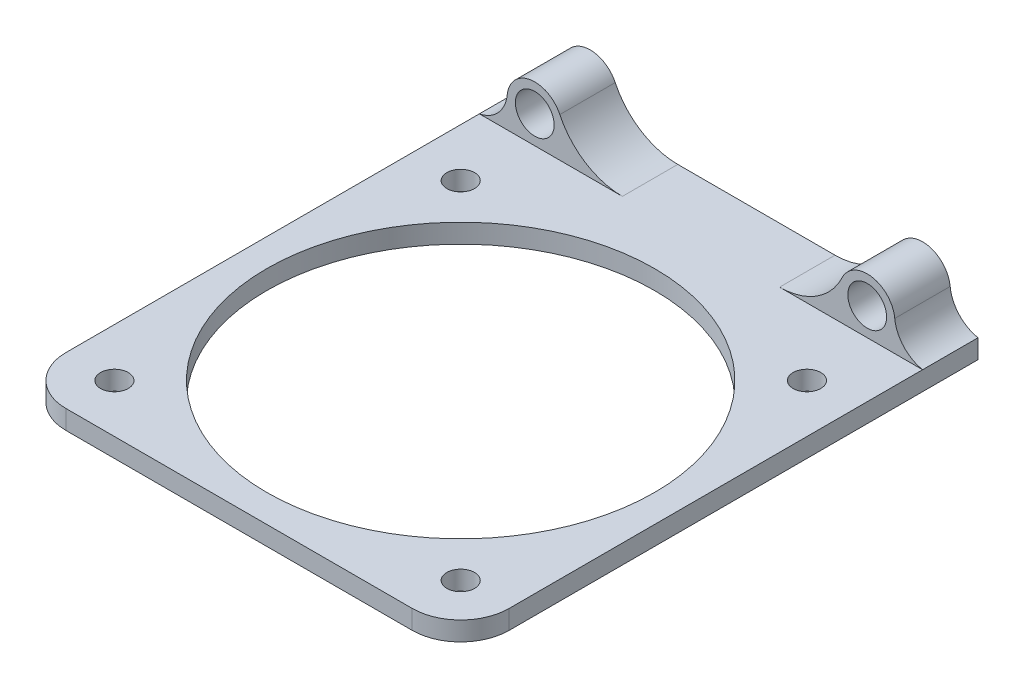
from build123d import *

# Parameters (mm, degrees)
SCHIZZO1_R                        = 2
ESTRUSIONE_ESTRUSIONE1_DEPTH      = 8
SCHIZZO3_W                        = 50
SCHIZZO3_H                        = 2.75
ESTRUSIONE_ESTRUSIONE3_DEPTH      = 55
RACCORDO1_R                       = 4
SCHIZZO4_R                        = 23
TAGLIO_ESTRUSIONE1_DEPTH          = 4
SCHIZZO5_R                        = 2
TAGLIO_ESTRUSIONE2_DEPTH          = 4
RACCORDO2_R                       = 124
SCHIZZO6_R                        = 2.8
TAGLIO_ESTRUSIONE3_DEPTH          = 4
SCHIZZO7_W                        = 64
SCHIZZO7_H                        = 66
SCHIZZO7_R                        = 28
ESTRUSIONE_ESTRUSIONE4_DEPTH      = 4
SCHIZZO8_R                        = 28
TAGLIO_ESTRUSIONE4_DEPTH          = 10
SCHIZZO9_R                        = 2
TAGLIO_ESTRUSIONE5_DEPTH          = 4
RACCORDO3_R                       = 3
RACCORDO4_R                       = 3
SCHIZZO10_W                       = 88.736042833
SCHIZZO10_H                       = 81.022332295
TAGLIO_ESTRUSIONE6_DEPTH          = 1.25
SCHIZZO11_W                       = 58
SCHIZZO11_H                       = 2.75
ESTRUSIONE_ESTRUSIONE5_DEPTH      = 0.7
RACCORDO6_START                   = -1
RACCORDO6_DEPTH                   = 5
RACCORDO8_START                   = -1
RACCORDO8_DEPTH                   = 5
ESTRUSIONE_ESTRUSIONE6_DEPTH      = 4
ESTRUSIONE_ESTRUSIONE6_DEPTH_BACK = 2.75
SCHIZZO12_W                       = 64
SCHIZZO12_H                       = 11.748328584
SCHIZZO14_W                       = 64
SCHIZZO14_H                       = 11.748328584
TAGLIO_ESTRUSIONE7_DEPTH          = 4
RACCORDO9_R                       = 10
RACCORDO10_R                      = 5


with BuildPart() as part:
    # Schizzo1 → Estrusione-Estrusione1 (new body)
    with BuildSketch(Plane.XY):
        with BuildLine():
            Line((-59.484364928, 0), (-3.484364928, 0))
            Line((-3.484364928, 0), (-3.484364928, 6.75))
            ThreePointArc((-3.484364928, 6.75), (-7.484364928, 10.75), (-11.484364928, 6.75))
            Line((-11.484364928, 6.75), (-11.484364928, 2.75))
            Line((-11.484364928, 2.75), (-23.484364928, 2.75))
            Line((-23.484364928, 2.75), (-39.484364928, 2.75))
            Line((-39.484364928, 2.75), (-51.484364928, 2.75))
            Line((-51.484364928, 2.75), (-51.484364928, 6.75))
            ThreePointArc((-51.484364928, 6.75), (-55.484364928, 10.75), (-59.484364928, 6.75))
            Line((-59.484364928, 6.75), (-59.484364928, 0))
        make_face()
        with Locations((-55.484364928, 6.75)):
            Circle(SCHIZZO1_R, mode=Mode.SUBTRACT)
        with Locations(Location((-7.484364928, 6.75, 0), (0, 0, 180))):
            Circle(SCHIZZO1_R, mode=Mode.SUBTRACT)
    extrude(amount=ESTRUSIONE_ESTRUSIONE1_DEPTH)

    # Schizzo3 → Estrusione-Estrusione3 (add)
    with BuildSketch(Plane.XY.offset(8)):
        with Locations((-31.482821648, 1.375)):
            Rectangle(SCHIZZO3_W, SCHIZZO3_H)
    extrude(amount=ESTRUSIONE_ESTRUSIONE3_DEPTH)

    # Raccordo1
    raccordo1_edges = [part.edges().sort_by_distance(p)[0] for p in [
        (-56.482821648, 1.375, 63),
        (-6.482821648, 1.375, 63),
    ]]
    fillet(raccordo1_edges, radius=RACCORDO1_R)

    # Schizzo4 → Taglio-Estrusione1 (cut)
    with BuildSketch(Plane(origin=(0, 2.75, 0), x_dir=(1, 0, 0), z_dir=(0, 1, 0))):
        with Locations(Location((-31.482821648, -35.97589666, 0), (0, 0, 180))):
            Circle(SCHIZZO4_R)
    extrude(amount=-TAGLIO_ESTRUSIONE1_DEPTH, mode=Mode.SUBTRACT)

    # Schizzo5 → Taglio-Estrusione2 (cut)
    with BuildSketch(Plane(origin=(0, 2.75, 0), x_dir=(1, 0, 0), z_dir=(0, 1, 0))):
        with Locations(Location((-51.482821648, -15.97589666, 0), (0, 0, 180))):
            Circle(SCHIZZO5_R)
        with Locations(Location((-51.482821648, -55.97589666, 0), (0, 0, 180))):
            Circle(SCHIZZO5_R)
        with Locations(Location((-11.482821648, -15.97589666, 0), (0, 0, 180))):
            Circle(SCHIZZO5_R)
        with Locations(Location((-11.482821648, -55.97589666, 0), (0, 0, 180))):
            Circle(SCHIZZO5_R)
    extrude(amount=-TAGLIO_ESTRUSIONE2_DEPTH, mode=Mode.SUBTRACT)

    # Raccordo2
    # the kernel refuses this fillet: 124 mm, written as the material it adds along each edge
    with BuildSketch(Plane(origin=(-56.482821648, 2.75, 8), x_dir=(0, 0, 1), z_dir=(0, -1, 0))) as raccordo2_piece_1:
        with BuildLine():
            CenterArc((27.117770399, 124), RACCORDO2_R, 257.367798326, 12.632201674)
            Line((0, 3.00154328), (0, 0))
            Line((0, 0), (27.117770399, 0))
        make_face()
    extrude(amount=2.75)
    with BuildSketch(Plane(origin=(-6.482821648, 0, 8), x_dir=(0, 0, 1), z_dir=(0, 1, 0))) as raccordo2_piece_2:
        with BuildLine():
            CenterArc((27.10399461, 124), RACCORDO2_R, 257.374321421, 12.625678579)
            Line((0, 2.99845672), (0, 0))
            Line((0, 0), (27.10399461, 0))
        make_face()
    extrude(amount=2.75)

    # Schizzo6 → Taglio-Estrusione3 (cut)
    with BuildSketch(Plane.XY.offset(8)):
        with Locations((-55.484364928, 6.75)):
            Circle(SCHIZZO6_R)
        with Locations((-7.48260826, 6.745335699)):
            Circle(SCHIZZO6_R)
    extrude(amount=-TAGLIO_ESTRUSIONE3_DEPTH, mode=Mode.SUBTRACT)

    # Schizzo7 → Estrusione-Estrusione4 (add)
    with BuildSketch(Plane(origin=(0, 2.75, 0), x_dir=(1, 0, 0), z_dir=(0, 1, 0))):
        with Locations((-31.484364928, -41)):
            Rectangle(SCHIZZO7_W, SCHIZZO7_H)
        with Locations(Location((-31.484364928, -42.7, 0), (0, 0, 180))):
            Circle(SCHIZZO7_R, mode=Mode.SUBTRACT)
    extrude(amount=-ESTRUSIONE_ESTRUSIONE4_DEPTH)

    # Schizzo8 → Taglio-Estrusione4 (cut)
    with BuildSketch(Plane(origin=(0, 2.75, 0), x_dir=(1, 0, 0), z_dir=(0, 1, 0))):
        with Locations(Location((-31.484364928, -42.7, 0), (0, 0, 180))):
            Circle(SCHIZZO8_R)
    extrude(amount=-TAGLIO_ESTRUSIONE4_DEPTH, mode=Mode.SUBTRACT)

    # Schizzo9 → Taglio-Estrusione5 (cut)
    with BuildSketch(Plane(origin=(0, 2.75, 0), x_dir=(1, 0, 0), z_dir=(0, 1, 0))):
        with Locations(Location((-6.484364928, -67.7, 0), (0, 0, 180))):
            Circle(SCHIZZO9_R)
        with Locations((-6.484364928, -17.7)):
            Circle(SCHIZZO9_R)
        with Locations((-56.484364928, -67.7)):
            Circle(SCHIZZO9_R)
        with Locations(Location((-56.484364928, -17.7, 0), (0, 0, 180))):
            Circle(SCHIZZO9_R)
    extrude(amount=-TAGLIO_ESTRUSIONE5_DEPTH, mode=Mode.SUBTRACT)

    # Raccordo3
    # the kernel refuses this fillet: 3 mm, written as the material it adds along each edge
    with BuildSketch(Plane(origin=(-59.484364928, 0, 8), x_dir=(0, -1, 0), z_dir=(1, 0, 0))) as raccordo3_piece_1:
        with BuildLine():
            CenterArc((3, 2.436698586), RACCORDO3_R, 180, 54.314665287)
            Line((0, 2.436698586), (0, 0))
            Line((0, 0), (1.25, 0))
        make_face()
    extrude(amount=56)
    with BuildSketch(Plane(origin=(-3.484364928, 0, 8), x_dir=(1, 0, 0), z_dir=(0, 1, 0)), Plane(origin=(-59.484364928, 2.75, 8), x_dir=(-1, 0, 0), z_dir=(0, -1, 0))) as raccordo3_piece_2:
        with BuildLine():
            CenterArc((RACCORDO3_R, RACCORDO3_R), RACCORDO3_R, 180, 90)
            Line((0, RACCORDO3_R), (0, 0))
            Line((0, 0), (RACCORDO3_R, 0))
        make_face()
    extrude(amount=2.75)
    with BuildSketch(Plane(origin=(-65.576111393, 0, 8), x_dir=(0, -1, 0), z_dir=(1, 0, 0))) as raccordo3_piece_3a_section:
        with BuildLine():
            CenterArc((3, 2.436698586), RACCORDO3_R, 180, 54.314665287)
            Line((0, 2.436698586), (0, 0))
            Line((0, 0), (1.25, 0))
        make_face()
    raccordo3_piece_3a = extrude(amount=62.091746466, mode=Mode.PRIVATE)
    raccordo3_piece_3a = split(raccordo3_piece_3a, bisect_by=Plane(origin=(-63.484364928, 0, 8), z_dir=(1, 0, 0)), keep=Keep.TOP, mode=Mode.PRIVATE)
    raccordo3_piece_3a = split(raccordo3_piece_3a, bisect_by=Plane(origin=(-59.484364928, 0, 8), z_dir=(-1, 0, 0)), keep=Keep.TOP, mode=Mode.PRIVATE)
    with BuildSketch(Plane(origin=(-59.484364928, 2.75, 8), x_dir=(-1, 0, 0), z_dir=(0, -1, 0))) as raccordo3_piece_3b_section:
        with BuildLine():
            CenterArc((RACCORDO3_R, RACCORDO3_R), RACCORDO3_R, 180, 90)
            Line((0, RACCORDO3_R), (0, 0))
            Line((0, 0), (RACCORDO3_R, 0))
        make_face()
    raccordo3_piece_3b = extrude(amount=10.25, mode=Mode.PRIVATE)
    raccordo3_piece_3b = split(raccordo3_piece_3b, bisect_by=Plane(origin=(-59.484364928, 0, 8), z_dir=(0, -1, 0)), keep=Keep.TOP, mode=Mode.PRIVATE)
    raccordo3_piece_3b = split(raccordo3_piece_3b, bisect_by=Plane(origin=(-59.484364928, -1.25, 8), z_dir=(0, 1, 0)), keep=Keep.TOP, mode=Mode.PRIVATE)
    raccordo3_piece_3 = raccordo3_piece_3a & raccordo3_piece_3b
    add(raccordo3_piece_3)
    with BuildSketch(Plane(origin=(-3.484364928, -7.5, 8), x_dir=(1, 0, 0), z_dir=(0, 1, 0))) as raccordo3_piece_4a_section:
        with BuildLine():
            CenterArc((RACCORDO3_R, RACCORDO3_R), RACCORDO3_R, 180, 90)
            Line((0, RACCORDO3_R), (0, 0))
            Line((0, 0), (RACCORDO3_R, 0))
        make_face()
    raccordo3_piece_4a = extrude(amount=10.25, mode=Mode.PRIVATE)
    raccordo3_piece_4a = split(raccordo3_piece_4a, bisect_by=Plane(origin=(-3.484364928, 0, 8), z_dir=(0, -1, 0)), keep=Keep.TOP, mode=Mode.PRIVATE)
    raccordo3_piece_4a = split(raccordo3_piece_4a, bisect_by=Plane(origin=(-3.484364928, -1.25, 8), z_dir=(0, 1, 0)), keep=Keep.TOP, mode=Mode.PRIVATE)
    with BuildSketch(Plane(origin=(-59.484364928, 0, 8), x_dir=(0, -1, 0), z_dir=(1, 0, 0))) as raccordo3_piece_4b_section:
        with BuildLine():
            CenterArc((3, 2.436698586), RACCORDO3_R, 180, 54.314665287)
            Line((0, 2.436698586), (0, 0))
            Line((0, 0), (1.25, 0))
        make_face()
    raccordo3_piece_4b = extrude(amount=62.091746466, mode=Mode.PRIVATE)
    raccordo3_piece_4b = split(raccordo3_piece_4b, bisect_by=Plane(origin=(0.515635072, 0, 8), z_dir=(-1, 0, 0)), keep=Keep.TOP, mode=Mode.PRIVATE)
    raccordo3_piece_4b = split(raccordo3_piece_4b, bisect_by=Plane(origin=(-3.484364928, 0, 8), z_dir=(1, 0, 0)), keep=Keep.TOP, mode=Mode.PRIVATE)
    raccordo3_piece_4 = raccordo3_piece_4a & raccordo3_piece_4b
    add(raccordo3_piece_4)
    # the kernel refuses this fillet: 3 mm, written as the material it takes off along each edge
    with BuildSketch(Plane(origin=(0.515635072, 10.25, 74), x_dir=(-1, 0, 0), z_dir=(0, -1, 0)), Plane(origin=(-63.484364928, 10.25, 74), x_dir=(0, 0, -1), z_dir=(0, -1, 0))) as raccordo3_2_piece_1:
        with BuildLine():
            CenterArc((RACCORDO3_R, RACCORDO3_R), RACCORDO3_R, 180, 90)
            Line((0, RACCORDO3_R), (0, 0))
            Line((0, 0), (RACCORDO3_R, 0))
        make_face()
    extrude(amount=19, mode=Mode.SUBTRACT)

    # Raccordo4
    # the kernel refuses this fillet: 3 mm, written as the material it takes off along each edge
    with BuildSketch(Plane(origin=(-63.484364928, 9.392135624, 8), x_dir=(0.9963405296085128, 0, -0.08547250469845889), z_dir=(0, -1, 0))) as raccordo4_piece_1:
        with BuildLine():
            CenterArc((2.761933602, 2.903549084), RACCORDO4_R, 184.903196278, 70.528779366)
            Line((-0.227087987, 2.64713157), (-0.525990146, 2.621489819))
            Line((-0.525990146, 2.621489819), (-0.298902159, -0.025641751))
            Line((-0.298902159, -0.025641751), (0.025641751, -0.298902159))
            ThreePointArc((0.025641751, -0.298902159), (1.021982281, -0.213429654), (1.931887045, -0.290354908))
            Line((1.931887045, -0.290354908), (2.007345823, 0))
        make_face()
    extrude(amount=17.284271247, mode=Mode.SUBTRACT)
    with BuildSketch(Plane(origin=(0.515635072, 9.392135624, 8), x_dir=(-0.9963405296085196, 0, -0.08547250469837912), z_dir=(0, -1, 0))) as raccordo4_piece_2:
        with BuildLine():
            CenterArc((2.761933602, -2.903549084), RACCORDO4_R, 104.568024357, 70.528779366)
            Line((-0.227087987, -2.64713157), (-0.525990146, -2.621489819))
            Line((-0.525990146, -2.621489819), (-0.298902159, 0.025641751))
            Line((-0.298902159, 0.025641751), (0.025641751, 0.298902159))
            ThreePointArc((0.025641751, 0.298902159), (1.021982281, 0.213429654), (1.931887045, 0.290354908))
            Line((1.931887045, 0.290354908), (2.007345823, 0))
        make_face()
    extrude(amount=17.284271247, mode=Mode.SUBTRACT)

    # Schizzo10 → Taglio-Estrusione6 (cut)
    with BuildSketch(Plane.XZ.offset(1.25)):
        with Locations((-36.992061707, 40.511166147)):
            Rectangle(SCHIZZO10_W, SCHIZZO10_H)
    extrude(amount=-TAGLIO_ESTRUSIONE6_DEPTH, mode=Mode.SUBTRACT)

    # Schizzo11 → Estrusione-Estrusione5 (add)
    with BuildSketch(Plane.XY.offset(74)):
        with Locations((-31.484364928, 1.375)):
            Rectangle(SCHIZZO11_W, SCHIZZO11_H)
    extrude(amount=ESTRUSIONE_ESTRUSIONE5_DEPTH)

    # Raccordo6: read off the stored shape, not the designer's step
    # Raccordo6 outline → Raccordo6 (cut)
    with BuildSketch(Plane(origin=(0, 0, 0), x_dir=(1, 0, 0), z_dir=(0, 1, 0)).offset(RACCORDO6_START)):
        with BuildLine():
            Line((-60.484364928, -74.7), (-56.484364928, -74.7))
            ThreePointArc((-56.484364928, -74.7), (-61.434112396, -72.649747468), (-63.484364928, -67.7))
            Line((-63.484364928, -67.7), (-63.484364928, -71))
            ThreePointArc((-63.484364928, -71), (-62.605685271, -73.121320344), (-60.484364928, -74))
            Line((-60.484364928, -74), (-60.484364928, -74.7))
        make_face()
    extrude(amount=RACCORDO6_DEPTH, mode=Mode.SUBTRACT)

    # Raccordo8: read off the stored shape, not the designer's step
    # Raccordo8 outline → Raccordo8 (cut)
    with BuildSketch(Plane(origin=(0, 0, 0), x_dir=(1, 0, 0), z_dir=(0, 1, 0)).offset(RACCORDO8_START)):
        with BuildLine():
            ThreePointArc((0.515635072, -67.7), (-1.53461746, -72.649747468), (-6.484364928, -74.7))
            Line((-6.484364928, -74.7), (-2.484364928, -74.7))
            Line((-2.484364928, -74.7), (-2.484364928, -74))
            ThreePointArc((-2.484364928, -74), (-0.363044584, -73.121320344), (0.515635072, -71))
            Line((0.515635072, -71), (0.515635072, -67.7))
        make_face()
    extrude(amount=RACCORDO8_DEPTH, mode=Mode.SUBTRACT)

    # Schizzo12 → Estrusione-Estrusione6 (add, two sides: drawn at the far end of the back side and taken through both)
    with BuildSketch(Plane.XZ.offset(-ESTRUSIONE_ESTRUSIONE6_DEPTH_BACK)):
        with Locations((-31.484364928, 5.874164292)):
            Rectangle(SCHIZZO12_W, SCHIZZO12_H)
    extrude(amount=ESTRUSIONE_ESTRUSIONE6_DEPTH + ESTRUSIONE_ESTRUSIONE6_DEPTH_BACK)

    # Schizzo14 → Taglio-Estrusione7 (cut)
    with BuildSketch(Plane.XZ.offset(4)):
        with Locations((-31.484364928, 5.874164292)):
            Rectangle(SCHIZZO14_W, SCHIZZO14_H)
    extrude(amount=-TAGLIO_ESTRUSIONE7_DEPTH, mode=Mode.SUBTRACT)

    # Raccordo9
    # the kernel refuses this fillet: 10 mm, written as the material it adds along each edge
    with BuildSketch(Plane(origin=(-11.484364928, 2.75, 0), x_dir=(-1, 0, 0), z_dir=(0, 0, 1))) as raccordo9_piece_1:
        with BuildLine():
            CenterArc((8.649110641, -10), RACCORDO9_R, 90, 64.623066475)
            Line((-0.385968388, -5.714285714), (-1.289476291, -5.285714286))
            ThreePointArc((-1.289476291, -5.285714286), (-1, -4), (-1, 0))
            Line((-1, 0), (0, 1))
            Line((0, 1), (8.649110641, 1))
            Line((8.649110641, 1), (8.649110641, 0))
        make_face()
    extrude(amount=8)
    with BuildSketch(Plane(origin=(-51.484364928, 2.75, 0), x_dir=(1, 0, 0), z_dir=(0, 0, 1))) as raccordo9_piece_2:
        with BuildLine():
            CenterArc((8.649110641, 10), RACCORDO9_R, 205.376933525, 64.623066475)
            Line((-0.385968388, 5.714285714), (-1.289476291, 5.285714286))
            ThreePointArc((-1.289476291, 5.285714286), (-1, 4), (-1, 0))
            Line((-1, 0), (0, -1))
            Line((0, -1), (8.649110641, -1))
            Line((8.649110641, -1), (8.649110641, 0))
        make_face()
    extrude(amount=8)

    # Raccordo10
    # the kernel refuses this fillet: 5 mm, written as the material it adds along each edge
    with BuildSketch(Plane(origin=(-3.484364928, 2.75, 0), x_dir=(-0.00463594795173994, 0.9999892539355554, 0), z_dir=(0, 0, 1)), Plane(origin=(-59.484364928, 2.75, 8), x_dir=(0.0046359479517115295, 0.9999892539355555, 0), z_dir=(0, 0, -1))) as raccordo10_piece_1:
        with BuildLine():
            CenterArc((4.885112311, -4.97676653), RACCORDO10_R, 95.525581396, 73.208552885)
            Line((-0.018543792, -3.999957016), (-0.508909402, -3.902276064))
            ThreePointArc((-0.508909402, -3.902276064), (-0.509266523, -1.997660534), (-0.499994627, 0.002317974))
            Line((-0.499994627, 0.002317974), (0.002317974, 0.499994627))
            ThreePointArc((0.002317974, 0.499994627), (4.00227499, 0.481450835), (4.355516392, 0.497676653))
            Line((4.355516392, 0.497676653), (4.403661476, 0))
        make_face()
    extrude(amount=8)


solid = part.part
